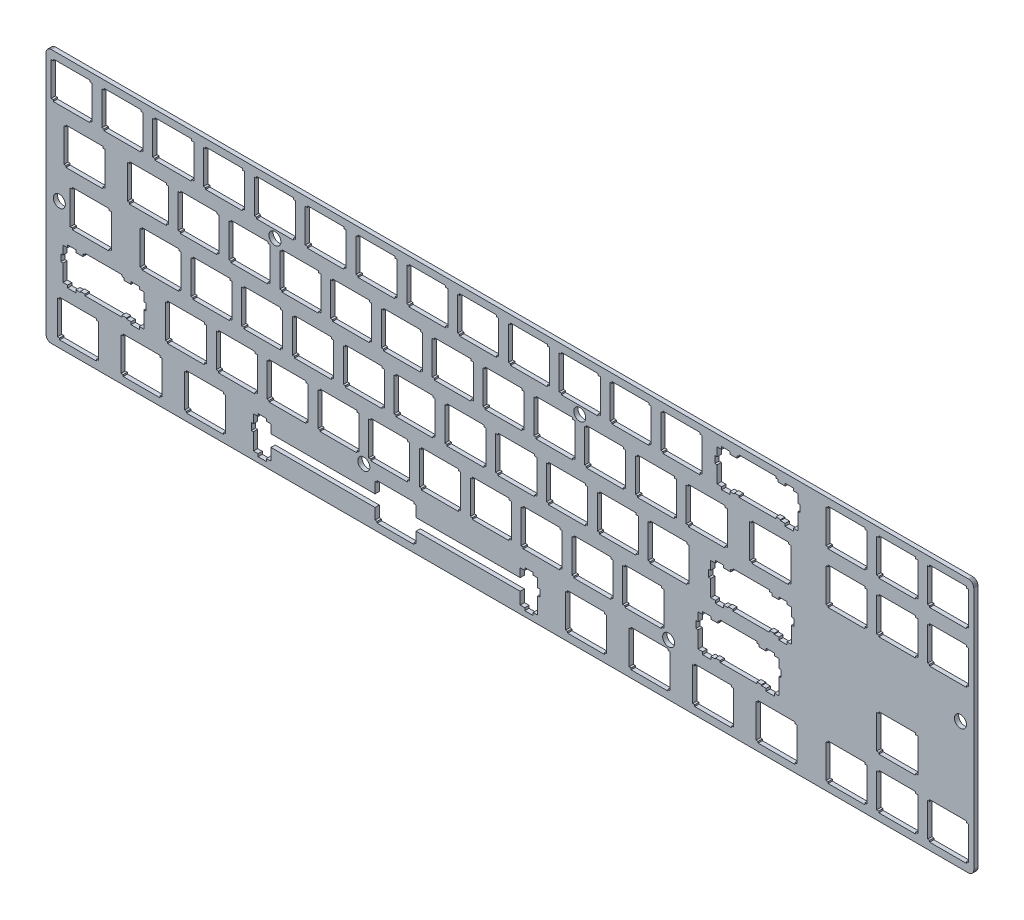
from build123d import *

# Parameters (mm, degrees)
MODEL_R             = 2.25
BOSS_EXTRUDE1_DEPTH = 1.5875


with BuildPart() as part:
    # Model → Boss-Extrude1 (new body)
    with BuildSketch(Plane.XY):
        Polygon((370.515556908, 199.863340857), (370.672556908, 199.856640857), (370.829556908, 199.838640857), (370.982556908, 199.808340857), (371.134556908, 199.765640857), (371.281556908, 199.710640857), (371.423556908, 199.645640857), (371.561556908, 199.568740857), (371.692556908, 199.481640857), (371.815556908, 199.383940857), (371.930556908, 199.277740857), (372.036556908, 199.162040857), (372.134556908, 199.039640857), (372.221556908, 198.908340857), (372.298556908, 198.770840857), (372.363556908, 198.628640857), (372.418556908, 198.482540857), (372.461556908, 198.329840857), (372.491556908, 198.176740857), (372.509556908, 198.019740857), (372.516556908, 197.862740857), (372.516556908, 106.413230857), (372.509556908, 106.256130857), (372.491556908, 106.100410857), (372.461556908, 105.946070857), (372.418556908, 105.794490857), (372.363556908, 105.647040857), (372.298556908, 105.505100857), (372.221556908, 105.368670857), (372.134556908, 105.237760857), (372.036556908, 105.113740857), (371.930556908, 104.997983857), (371.815556908, 104.891874857), (371.692556908, 104.794035857), (371.561556908, 104.707216857), (371.423556908, 104.630046857), (371.281556908, 104.565280857), (371.134556908, 104.510158857), (370.982556908, 104.467440857), (370.829556908, 104.437122857), (370.672556908, 104.419208857), (370.515556908, 104.413695857), (26.653556908, 104.413695857), (26.496456908, 104.419208857), (26.339356908, 104.437122857), (26.186396908, 104.467440857), (26.033436908, 104.510158857), (25.887366908, 104.565280857), (25.745426908, 104.630046857), (25.607616908, 104.707216857), (25.476708908, 104.794035857), (25.354061908, 104.891874857), (25.238308908, 104.997983857), (25.132199908, 105.113740857), (25.034356908, 105.237760857), (24.947541908, 105.368670857), (24.870371908, 105.505100857), (24.805603908, 105.647040857), (24.750481908, 105.794490857), (24.707762908, 105.946070857), (24.677445908, 106.100410857), (24.659531908, 106.256130857), (24.652641508, 106.411850857), (24.652641508, 197.862740857), (24.659531908, 198.019740857), (24.677445908, 198.176740857), (24.707762908, 198.329840857), (24.750481908, 198.482540857), (24.805603908, 198.628640857), (24.870371908, 198.770840857), (24.947541908, 198.908340857), (25.034356908, 199.039640857), (25.132199908, 199.162040857), (25.238308908, 199.277740857), (25.354061908, 199.383940857), (25.476708908, 199.481640857), (25.607616908, 199.568740857), (25.745426908, 199.645640857), (25.887366908, 199.710640857), (26.033436908, 199.765640857), (26.186396908, 199.808340857), (26.339356908, 199.838640857), (26.496456908, 199.856640857), (26.653556908, 199.863340857), align=None)
        with Locations((143.815056908, 123.864140857)):
            Circle(MODEL_R, mode=Mode.SUBTRACT)
        with Locations((110.477456908, 180.414140857)):
            Circle(MODEL_R, mode=Mode.SUBTRACT)
        with Locations((224.778056908, 180.414140857)):
            Circle(MODEL_R, mode=Mode.SUBTRACT)
        with Locations((258.115056908, 123.864140857)):
            Circle(MODEL_R, mode=Mode.SUBTRACT)
        Polygon((148.820556908, 120.939140857), (148.820556908, 120.339640857), (148.021556908, 120.339640857), (148.021556908, 116.238640857), (108.995656908, 116.238640857), (108.995656908, 119.468740857), (107.271556908, 119.468740857), (107.271556908, 120.387940857), (104.171056908, 120.387940857), (104.171056908, 119.468740857), (102.445556908, 119.468740857), (102.445556908, 116.238640857), (101.621556908, 116.238640857), (101.621556908, 113.638280857), (102.445556908, 113.638280857), (102.445556908, 107.369590857), (104.171056908, 107.369590857), (104.171056908, 106.388420857), (107.271556908, 106.388420857), (107.271556908, 107.369590857), (108.995656908, 107.369590857), (108.995656908, 111.838550857), (148.021556908, 111.838550857), (148.021556908, 107.738890857), (148.820556908, 107.738890857), (148.820556908, 107.138080857), (162.620556908, 107.138080857), (162.620556908, 107.738890857), (163.421556908, 107.738890857), (163.421556908, 111.838550857), (202.445556908, 111.838550857), (202.445556908, 107.369590857), (204.171556908, 107.369590857), (204.171556908, 106.388420857), (207.271556908, 106.388420857), (207.271556908, 107.369590857), (208.995556908, 107.369590857), (208.995556908, 113.638280857), (209.820556908, 113.638280857), (209.820556908, 116.238640857), (208.995556908, 116.238640857), (208.995556908, 119.468740857), (207.271556908, 119.468740857), (207.271556908, 120.387940857), (204.171556908, 120.387940857), (204.171556908, 119.468740857), (202.445556908, 119.468740857), (202.445556908, 116.238640857), (163.421556908, 116.238640857), (163.421556908, 120.339640857), (162.620556908, 120.339640857), (162.620556908, 120.939140857), align=None, mode=Mode.SUBTRACT)
        Polygon((355.989556908, 120.939140857), (355.989556908, 120.339640857), (355.190556908, 120.339640857), (355.190556908, 107.738890857), (355.989556908, 107.738890857), (355.989556908, 107.138080857), (369.790556908, 107.138080857), (369.790556908, 107.738890857), (370.589556908, 107.738890857), (370.589556908, 120.339640857), (369.790556908, 120.339640857), (369.790556908, 120.939140857), align=None, mode=Mode.SUBTRACT)
        Polygon((336.939556908, 120.939140857), (336.939556908, 120.339640857), (336.140556908, 120.339640857), (336.140556908, 107.738890857), (336.939556908, 107.738890857), (336.939556908, 107.138080857), (350.740556908, 107.138080857), (350.740556908, 107.738890857), (351.539556908, 107.738890857), (351.539556908, 120.339640857), (350.740556908, 120.339640857), (350.740556908, 120.939140857), align=None, mode=Mode.SUBTRACT)
        Polygon((317.889556908, 120.939140857), (317.889556908, 120.339640857), (317.090556908, 120.339640857), (317.090556908, 107.738890857), (317.889556908, 107.738890857), (317.889556908, 107.138080857), (331.690556908, 107.138080857), (331.690556908, 107.738890857), (332.489556908, 107.738890857), (332.489556908, 120.339640857), (331.690556908, 120.339640857), (331.690556908, 120.939140857), align=None, mode=Mode.SUBTRACT)
        Polygon((291.695556908, 120.939140857), (291.695556908, 120.339640857), (290.896556908, 120.339640857), (290.896556908, 107.738890857), (291.695556908, 107.738890857), (291.695556908, 107.138080857), (305.495556908, 107.138080857), (305.495556908, 107.738890857), (306.296556908, 107.738890857), (306.296556908, 120.339640857), (305.495556908, 120.339640857), (305.495556908, 120.939140857), align=None, mode=Mode.SUBTRACT)
        Polygon((267.884556908, 120.939140857), (267.884556908, 120.339640857), (267.084556908, 120.339640857), (267.084556908, 107.738890857), (267.884556908, 107.738890857), (267.884556908, 107.138080857), (281.684556908, 107.138080857), (281.684556908, 107.738890857), (282.483556908, 107.738890857), (282.483556908, 120.339640857), (281.684556908, 120.339640857), (281.684556908, 120.939140857), align=None, mode=Mode.SUBTRACT)
        Polygon((244.070556908, 120.939140857), (244.070556908, 120.339640857), (243.271556908, 120.339640857), (243.271556908, 107.738890857), (244.070556908, 107.738890857), (244.070556908, 107.138080857), (257.870556908, 107.138080857), (257.870556908, 107.738890857), (258.671556908, 107.738890857), (258.671556908, 120.339640857), (257.870556908, 120.339640857), (257.870556908, 120.939140857), align=None, mode=Mode.SUBTRACT)
        Polygon((220.259556908, 120.939140857), (220.259556908, 120.339640857), (219.459556908, 120.339640857), (219.459556908, 107.738890857), (220.259556908, 107.738890857), (220.259556908, 107.138080857), (234.059556908, 107.138080857), (234.059556908, 107.738890857), (234.858556908, 107.738890857), (234.858556908, 120.339640857), (234.059556908, 120.339640857), (234.059556908, 120.939140857), align=None, mode=Mode.SUBTRACT)
        Polygon((77.384656908, 120.939140857), (77.384656908, 120.339640857), (76.584156908, 120.339640857), (76.584156908, 107.738890857), (77.384656908, 107.738890857), (77.384656908, 107.138080857), (91.184256908, 107.138080857), (91.184256908, 107.738890857), (91.983656908, 107.738890857), (91.983656908, 120.339640857), (91.184256908, 120.339640857), (91.184256908, 120.939140857), align=None, mode=Mode.SUBTRACT)
        Polygon((53.570756908, 120.939140857), (53.570756908, 120.339640857), (52.771556908, 120.339640857), (52.771556908, 107.738890857), (53.570756908, 107.738890857), (53.570756908, 107.138080857), (67.370356908, 107.138080857), (67.370356908, 107.738890857), (68.171156908, 107.738890857), (68.171156908, 120.339640857), (67.370356908, 120.339640857), (67.370356908, 120.939140857), align=None, mode=Mode.SUBTRACT)
        Polygon((29.759656908, 120.939140857), (29.759656908, 120.339640857), (28.959026908, 120.339640857), (28.959026908, 107.738890857), (29.759656908, 107.738890857), (29.759656908, 107.138080857), (43.559356908, 107.138080857), (43.559356908, 107.738890857), (44.358556908, 107.738890857), (44.358556908, 120.339640857), (43.559356908, 120.339640857), (43.559356908, 120.939140857), align=None, mode=Mode.SUBTRACT)
        Polygon((277.408556908, 139.990640857), (277.408556908, 139.389840857), (276.609556908, 139.389840857), (276.609556908, 138.518740857), (275.684556908, 138.518740857), (273.959556908, 138.518740857), (273.959556908, 139.437840857), (270.858556908, 139.437840857), (270.858556908, 138.518740857), (269.134556908, 138.518740857), (269.134556908, 135.288640857), (268.308556908, 135.288640857), (268.308556908, 132.688240857), (269.134556908, 132.688240857), (269.134556908, 126.418240857), (270.858556908, 126.418240857), (270.858556908, 125.438440857), (273.959556908, 125.438440857), (273.959556908, 126.418240857), (275.684556908, 126.418240857), (275.684556908, 126.788840857), (276.609556908, 126.788840857), (277.408556908, 126.788840857), (277.408556908, 126.188040857), (291.209556908, 126.188040857), (291.209556908, 126.788840857), (292.008556908, 126.788840857), (292.934556908, 126.788840857), (292.934556908, 126.418240857), (294.658556908, 126.418240857), (294.658556908, 125.438440857), (297.759556908, 125.438440857), (297.759556908, 126.418240857), (299.484556908, 126.418240857), (299.484556908, 132.688240857), (300.308556908, 132.688240857), (300.308556908, 135.288640857), (299.484556908, 135.288640857), (299.484556908, 138.518740857), (297.759556908, 138.518740857), (297.759556908, 139.437840857), (294.658556908, 139.437840857), (294.658556908, 138.518740857), (292.934556908, 138.518740857), (292.008556908, 138.518740857), (292.008556908, 139.389840857), (291.209556908, 139.389840857), (291.209556908, 139.990640857), align=None, mode=Mode.SUBTRACT)
        Polygon((39.284656908, 139.990640857), (39.284656908, 139.389840857), (38.484056908, 139.389840857), (38.484056908, 138.518740857), (37.559356908, 138.518740857), (35.834056908, 138.518740857), (35.834056908, 139.437840857), (32.733466908, 139.437840857), (32.733466908, 138.518740857), (31.009546908, 138.518740857), (31.009546908, 135.288640857), (30.184076908, 135.288640857), (30.184076908, 132.688240857), (31.009546908, 132.688240857), (31.009546908, 126.418240857), (32.733466908, 126.418240857), (32.733466908, 125.438440857), (35.834056908, 125.438440857), (35.834056908, 126.418240857), (37.559356908, 126.418240857), (37.559356908, 126.788840857), (38.484056908, 126.788840857), (39.284656908, 126.788840857), (39.284656908, 126.188040857), (53.084356908, 126.188040857), (53.084356908, 126.788840857), (53.883556908, 126.788840857), (54.809656908, 126.788840857), (54.809656908, 126.418240857), (56.533556908, 126.418240857), (56.533556908, 125.438440857), (59.634156908, 125.438440857), (59.634156908, 126.418240857), (61.359356908, 126.418240857), (61.359356908, 132.688240857), (62.183456908, 132.688240857), (62.183456908, 135.288640857), (61.359356908, 135.288640857), (61.359356908, 138.518740857), (59.634156908, 138.518740857), (59.634156908, 139.437840857), (56.533556908, 139.437840857), (56.533556908, 138.518740857), (54.809656908, 138.518740857), (53.883556908, 138.518740857), (53.883556908, 139.389840857), (53.084356908, 139.389840857), (53.084356908, 139.990640857), align=None, mode=Mode.SUBTRACT)
        Polygon((299.153556908, 195.668840857), (300.078556908, 195.668840857), (301.803556908, 195.668840857), (301.803556908, 196.589240857), (304.902556908, 196.589240857), (304.902556908, 195.668840857), (306.628556908, 195.668840857), (306.628556908, 192.438740857), (307.453556908, 192.438740857), (307.453556908, 189.838440857), (306.628556908, 189.838440857), (306.628556908, 183.568140857), (304.902556908, 183.568140857), (304.902556908, 182.588540857), (301.803556908, 182.588540857), (301.803556908, 183.568140857), (300.078556908, 183.568140857), (300.078556908, 183.937540857), (299.153556908, 183.937540857), (298.352556908, 183.937540857), (298.352556908, 183.338140857), (284.553556908, 183.338140857), (284.553556908, 183.937540857), (283.752556908, 183.937540857), (282.827556908, 183.937540857), (282.827556908, 183.568140857), (281.102556908, 183.568140857), (281.102556908, 182.588540857), (278.003556908, 182.588540857), (278.003556908, 183.568140857), (276.278556908, 183.568140857), (276.278556908, 189.838440857), (275.452556908, 189.838440857), (275.452556908, 192.438740857), (276.278556908, 192.438740857), (276.278556908, 195.668840857), (278.003556908, 195.668840857), (278.003556908, 196.589240857), (281.102556908, 196.589240857), (281.102556908, 195.668840857), (282.827556908, 195.668840857), (283.752556908, 195.668840857), (283.752556908, 196.538440857), (284.553556908, 196.538440857), (284.553556908, 197.137740857), (298.352556908, 197.137740857), (298.352556908, 196.538440857), (299.153556908, 196.538440857), align=None, mode=Mode.SUBTRACT)
        Polygon((296.771556908, 157.568840857), (297.695556908, 157.568840857), (299.421556908, 157.568840857), (299.421556908, 158.489240857), (302.521556908, 158.489240857), (302.521556908, 157.568840857), (304.245556908, 157.568840857), (304.245556908, 154.338740857), (305.070556908, 154.338740857), (305.070556908, 151.739540857), (304.245556908, 151.739540857), (304.245556908, 145.469640857), (302.521556908, 145.469640857), (302.521556908, 144.488540857), (299.421556908, 144.488540857), (299.421556908, 145.469640857), (297.695556908, 145.469640857), (297.695556908, 145.838940857), (296.771556908, 145.838940857), (295.970556908, 145.838940857), (295.970556908, 145.239540857), (282.170556908, 145.239540857), (282.170556908, 145.838940857), (281.371556908, 145.838940857), (280.445556908, 145.838940857), (280.445556908, 145.469640857), (278.720556908, 145.469640857), (278.720556908, 144.488540857), (275.620556908, 144.488540857), (275.620556908, 145.469640857), (273.895556908, 145.469640857), (273.895556908, 151.739540857), (273.071556908, 151.739540857), (273.071556908, 154.338740857), (273.895556908, 154.338740857), (273.895556908, 157.568840857), (275.620556908, 157.568840857), (275.620556908, 158.489240857), (278.720556908, 158.489240857), (278.720556908, 157.568840857), (280.445556908, 157.568840857), (281.371556908, 157.568840857), (281.371556908, 158.438440857), (282.170556908, 158.438440857), (282.170556908, 159.039240857), (295.970556908, 159.039240857), (295.970556908, 158.438440857), (296.771556908, 158.438440857), align=None, mode=Mode.SUBTRACT)
        Polygon((336.939556908, 139.990640857), (336.939556908, 139.389840857), (336.140556908, 139.389840857), (336.140556908, 126.788840857), (336.939556908, 126.788840857), (336.939556908, 126.188040857), (350.740556908, 126.188040857), (350.740556908, 126.788840857), (351.539556908, 126.788840857), (351.539556908, 139.389840857), (350.740556908, 139.389840857), (350.740556908, 139.990640857), align=None, mode=Mode.SUBTRACT)
        Polygon((241.689556908, 139.990640857), (241.689556908, 139.389840857), (240.890556908, 139.389840857), (240.890556908, 126.788840857), (241.689556908, 126.788840857), (241.689556908, 126.188040857), (255.490556908, 126.188040857), (255.490556908, 126.788840857), (256.289556908, 126.788840857), (256.289556908, 139.389840857), (255.490556908, 139.389840857), (255.490556908, 139.990640857), align=None, mode=Mode.SUBTRACT)
        Polygon((222.639556908, 139.990640857), (222.639556908, 139.389840857), (221.840556908, 139.389840857), (221.840556908, 126.788840857), (222.639556908, 126.788840857), (222.639556908, 126.188040857), (236.440556908, 126.188040857), (236.440556908, 126.788840857), (237.239556908, 126.788840857), (237.239556908, 139.389840857), (236.440556908, 139.389840857), (236.440556908, 139.990640857), align=None, mode=Mode.SUBTRACT)
        Polygon((203.589556908, 139.990640857), (203.589556908, 139.389840857), (202.790556908, 139.389840857), (202.790556908, 126.788840857), (203.589556908, 126.788840857), (203.589556908, 126.188040857), (217.390556908, 126.188040857), (217.390556908, 126.788840857), (218.189556908, 126.788840857), (218.189556908, 139.389840857), (217.390556908, 139.389840857), (217.390556908, 139.990640857), align=None, mode=Mode.SUBTRACT)
        Polygon((184.539556908, 139.990640857), (184.539556908, 139.389840857), (183.740556908, 139.389840857), (183.740556908, 126.788840857), (184.539556908, 126.788840857), (184.539556908, 126.188040857), (198.340556908, 126.188040857), (198.340556908, 126.788840857), (199.139556908, 126.788840857), (199.139556908, 139.389840857), (198.340556908, 139.389840857), (198.340556908, 139.990640857), align=None, mode=Mode.SUBTRACT)
        Polygon((165.489556908, 139.990640857), (165.489556908, 139.389840857), (164.690556908, 139.389840857), (164.690556908, 126.788840857), (165.489556908, 126.788840857), (165.489556908, 126.188040857), (179.290556908, 126.188040857), (179.290556908, 126.788840857), (180.089556908, 126.788840857), (180.089556908, 139.389840857), (179.290556908, 139.389840857), (179.290556908, 139.990640857), align=None, mode=Mode.SUBTRACT)
        Polygon((146.439556908, 139.990640857), (146.439556908, 139.389840857), (145.640556908, 139.389840857), (145.640556908, 126.788840857), (146.439556908, 126.788840857), (146.439556908, 126.188040857), (160.240556908, 126.188040857), (160.240556908, 126.788840857), (161.039556908, 126.788840857), (161.039556908, 139.389840857), (160.240556908, 139.389840857), (160.240556908, 139.990640857), align=None, mode=Mode.SUBTRACT)
        Polygon((127.389556908, 139.990640857), (127.389556908, 139.389840857), (126.590556908, 139.389840857), (126.590556908, 126.788840857), (127.389556908, 126.788840857), (127.389556908, 126.188040857), (141.190556908, 126.188040857), (141.190556908, 126.788840857), (141.989556908, 126.788840857), (141.989556908, 139.389840857), (141.190556908, 139.389840857), (141.190556908, 139.990640857), align=None, mode=Mode.SUBTRACT)
        Polygon((108.339456908, 139.990640857), (108.339456908, 139.389840857), (107.540456908, 139.389840857), (107.540456908, 126.788840857), (108.339456908, 126.788840857), (108.339456908, 126.188040857), (122.140456908, 126.188040857), (122.140456908, 126.788840857), (122.939856908, 126.788840857), (122.939856908, 139.389840857), (122.140456908, 139.389840857), (122.140456908, 139.990640857), align=None, mode=Mode.SUBTRACT)
        Polygon((89.289456908, 139.990640857), (89.289456908, 139.389840857), (88.490456908, 139.389840857), (88.490456908, 126.788840857), (89.289456908, 126.788840857), (89.289456908, 126.188040857), (103.090456908, 126.188040857), (103.090456908, 126.788840857), (103.889856908, 126.788840857), (103.889856908, 139.389840857), (103.090456908, 139.389840857), (103.090456908, 139.990640857), align=None, mode=Mode.SUBTRACT)
        Polygon((70.239456908, 139.990640857), (70.239456908, 139.389840857), (69.440456908, 139.389840857), (69.440456908, 126.788840857), (70.239456908, 126.788840857), (70.239456908, 126.188040857), (84.040456908, 126.188040857), (84.040456908, 126.788840857), (84.839856908, 126.788840857), (84.839856908, 139.389840857), (84.040456908, 139.389840857), (84.040456908, 139.990640857), align=None, mode=Mode.SUBTRACT)
        Polygon((251.214556908, 159.039240857), (251.214556908, 158.438440857), (250.415556908, 158.438440857), (250.415556908, 145.838940857), (251.214556908, 145.838940857), (251.214556908, 145.239540857), (265.015556908, 145.239540857), (265.015556908, 145.838940857), (265.814556908, 145.838940857), (265.814556908, 158.438440857), (265.015556908, 158.438440857), (265.015556908, 159.039240857), align=None, mode=Mode.SUBTRACT)
        Polygon((232.164556908, 159.039240857), (232.164556908, 158.438440857), (231.365556908, 158.438440857), (231.365556908, 145.838940857), (232.164556908, 145.838940857), (232.164556908, 145.239540857), (245.965556908, 145.239540857), (245.965556908, 145.838940857), (246.764556908, 145.838940857), (246.764556908, 158.438440857), (245.965556908, 158.438440857), (245.965556908, 159.039240857), align=None, mode=Mode.SUBTRACT)
        Polygon((213.114556908, 159.039240857), (213.114556908, 158.438440857), (212.315556908, 158.438440857), (212.315556908, 145.838940857), (213.114556908, 145.838940857), (213.114556908, 145.239540857), (226.915556908, 145.239540857), (226.915556908, 145.838940857), (227.714556908, 145.838940857), (227.714556908, 158.438440857), (226.915556908, 158.438440857), (226.915556908, 159.039240857), align=None, mode=Mode.SUBTRACT)
        Polygon((194.064556908, 159.039240857), (194.064556908, 158.438440857), (193.265556908, 158.438440857), (193.265556908, 145.838940857), (194.064556908, 145.838940857), (194.064556908, 145.239540857), (207.865556908, 145.239540857), (207.865556908, 145.838940857), (208.664556908, 145.838940857), (208.664556908, 158.438440857), (207.865556908, 158.438440857), (207.865556908, 159.039240857), align=None, mode=Mode.SUBTRACT)
        Polygon((175.014556908, 159.039240857), (175.014556908, 158.438440857), (174.215556908, 158.438440857), (174.215556908, 145.838940857), (175.014556908, 145.838940857), (175.014556908, 145.239540857), (188.815556908, 145.239540857), (188.815556908, 145.838940857), (189.614556908, 145.838940857), (189.614556908, 158.438440857), (188.815556908, 158.438440857), (188.815556908, 159.039240857), align=None, mode=Mode.SUBTRACT)
        Polygon((155.964556908, 159.039240857), (155.964556908, 158.438440857), (155.165556908, 158.438440857), (155.165556908, 145.838940857), (155.964556908, 145.838940857), (155.964556908, 145.239540857), (169.765556908, 145.239540857), (169.765556908, 145.838940857), (170.564556908, 145.838940857), (170.564556908, 158.438440857), (169.765556908, 158.438440857), (169.765556908, 159.039240857), align=None, mode=Mode.SUBTRACT)
        Polygon((136.914556908, 159.039240857), (136.914556908, 158.438440857), (136.115556908, 158.438440857), (136.115556908, 145.838940857), (136.914556908, 145.838940857), (136.914556908, 145.239540857), (150.715556908, 145.239540857), (150.715556908, 145.838940857), (151.514556908, 145.838940857), (151.514556908, 158.438440857), (150.715556908, 158.438440857), (150.715556908, 159.039240857), align=None, mode=Mode.SUBTRACT)
        Polygon((117.864456908, 159.039240857), (117.864456908, 158.438440857), (117.065456908, 158.438440857), (117.065456908, 145.838940857), (117.864456908, 145.838940857), (117.864456908, 145.239540857), (131.665556908, 145.239540857), (131.665556908, 145.838940857), (132.464556908, 145.838940857), (132.464556908, 158.438440857), (131.665556908, 158.438440857), (131.665556908, 159.039240857), align=None, mode=Mode.SUBTRACT)
        Polygon((98.814456908, 159.039240857), (98.814456908, 158.438440857), (98.015456908, 158.438440857), (98.015456908, 145.838940857), (98.814456908, 145.838940857), (98.814456908, 145.239540857), (112.615456908, 145.239540857), (112.615456908, 145.838940857), (113.414856908, 145.838940857), (113.414856908, 158.438440857), (112.615456908, 158.438440857), (112.615456908, 159.039240857), align=None, mode=Mode.SUBTRACT)
        Polygon((79.764456908, 159.039240857), (79.764456908, 158.438440857), (78.965456908, 158.438440857), (78.965456908, 145.838940857), (79.764456908, 145.838940857), (79.764456908, 145.239540857), (93.565456908, 145.239540857), (93.565456908, 145.838940857), (94.364856908, 145.838940857), (94.364856908, 158.438440857), (93.565456908, 158.438440857), (93.565456908, 159.039240857), align=None, mode=Mode.SUBTRACT)
        Polygon((60.714456908, 159.039240857), (60.714456908, 158.438440857), (59.915456908, 158.438440857), (59.915456908, 145.838940857), (60.714456908, 145.838940857), (60.714456908, 145.239540857), (74.515456908, 145.239540857), (74.515456908, 145.838940857), (75.314856908, 145.838940857), (75.314856908, 158.438440857), (74.515456908, 158.438440857), (74.515456908, 159.039240857), align=None, mode=Mode.SUBTRACT)
        Polygon((34.520776908, 159.039240857), (34.520776908, 158.438440857), (33.721526908, 158.438440857), (33.721526908, 145.838940857), (34.520776908, 145.838940857), (34.520776908, 145.239540857), (48.320456908, 145.239540857), (48.320456908, 145.838940857), (49.121056908, 145.838940857), (49.121056908, 158.438440857), (48.320456908, 158.438440857), (48.320456908, 159.039240857), align=None, mode=Mode.SUBTRACT)
        Polygon((355.989556908, 178.087740857), (355.989556908, 177.489840857), (355.190556908, 177.489840857), (355.190556908, 164.888940857), (355.989556908, 164.888940857), (355.989556908, 164.289540857), (369.790556908, 164.289540857), (369.790556908, 164.888940857), (370.589556908, 164.888940857), (370.589556908, 177.489840857), (369.790556908, 177.489840857), (369.790556908, 178.087740857), align=None, mode=Mode.SUBTRACT)
        Polygon((336.939556908, 178.087740857), (336.939556908, 177.489840857), (336.140556908, 177.489840857), (336.140556908, 164.888940857), (336.939556908, 164.888940857), (336.939556908, 164.289540857), (350.740556908, 164.289540857), (350.740556908, 164.888940857), (351.539556908, 164.888940857), (351.539556908, 177.489840857), (350.740556908, 177.489840857), (350.740556908, 178.087740857), align=None, mode=Mode.SUBTRACT)
        Polygon((317.889556908, 178.087740857), (317.889556908, 177.489840857), (317.090556908, 177.489840857), (317.090556908, 164.888940857), (317.889556908, 164.888940857), (317.889556908, 164.289540857), (331.690556908, 164.289540857), (331.690556908, 164.888940857), (332.489556908, 164.888940857), (332.489556908, 177.489840857), (331.690556908, 177.489840857), (331.690556908, 178.087740857), align=None, mode=Mode.SUBTRACT)
        Polygon((289.314556908, 178.087740857), (289.314556908, 177.489840857), (288.515556908, 177.489840857), (288.515556908, 164.888940857), (289.314556908, 164.888940857), (289.314556908, 164.289540857), (303.115556908, 164.289540857), (303.115556908, 164.888940857), (303.914556908, 164.888940857), (303.914556908, 177.489840857), (303.115556908, 177.489840857), (303.115556908, 178.087740857), align=None, mode=Mode.SUBTRACT)
        Polygon((265.503556908, 178.087740857), (265.503556908, 177.489840857), (264.702556908, 177.489840857), (264.702556908, 164.888940857), (265.503556908, 164.888940857), (265.503556908, 164.289540857), (279.301556908, 164.289540857), (279.301556908, 164.888940857), (280.103556908, 164.888940857), (280.103556908, 177.489840857), (279.301556908, 177.489840857), (279.301556908, 178.087740857), align=None, mode=Mode.SUBTRACT)
        Polygon((246.453556908, 178.087740857), (246.453556908, 177.489840857), (245.652556908, 177.489840857), (245.652556908, 164.888940857), (246.453556908, 164.888940857), (246.453556908, 164.289540857), (260.252556908, 164.289540857), (260.252556908, 164.888940857), (261.053556908, 164.888940857), (261.053556908, 177.489840857), (260.252556908, 177.489840857), (260.252556908, 178.087740857), align=None, mode=Mode.SUBTRACT)
        Polygon((227.403556908, 178.087740857), (227.403556908, 177.489840857), (226.602556908, 177.489840857), (226.602556908, 164.888940857), (227.403556908, 164.888940857), (227.403556908, 164.289540857), (241.202556908, 164.289540857), (241.202556908, 164.888940857), (242.003556908, 164.888940857), (242.003556908, 177.489840857), (241.202556908, 177.489840857), (241.202556908, 178.087740857), align=None, mode=Mode.SUBTRACT)
        Polygon((208.353556908, 178.087740857), (208.353556908, 177.489840857), (207.552556908, 177.489840857), (207.552556908, 164.888940857), (208.353556908, 164.888940857), (208.353556908, 164.289540857), (222.152556908, 164.289540857), (222.152556908, 164.888940857), (222.953556908, 164.888940857), (222.953556908, 177.489840857), (222.152556908, 177.489840857), (222.152556908, 178.087740857), align=None, mode=Mode.SUBTRACT)
        Polygon((189.303556908, 178.087740857), (189.303556908, 177.489840857), (188.502556908, 177.489840857), (188.502556908, 164.888940857), (189.303556908, 164.888940857), (189.303556908, 164.289540857), (203.102556908, 164.289540857), (203.102556908, 164.888940857), (203.903556908, 164.888940857), (203.903556908, 177.489840857), (203.102556908, 177.489840857), (203.102556908, 178.087740857), align=None, mode=Mode.SUBTRACT)
        Polygon((170.253556908, 178.087740857), (170.253556908, 177.489840857), (169.452556908, 177.489840857), (169.452556908, 164.888940857), (170.253556908, 164.888940857), (170.253556908, 164.289540857), (184.052556908, 164.289540857), (184.052556908, 164.888940857), (184.853556908, 164.888940857), (184.853556908, 177.489840857), (184.052556908, 177.489840857), (184.052556908, 178.087740857), align=None, mode=Mode.SUBTRACT)
        Polygon((151.201556908, 178.087740857), (151.201556908, 177.489840857), (150.402556908, 177.489840857), (150.402556908, 164.888940857), (151.201556908, 164.888940857), (151.201556908, 164.289540857), (165.002556908, 164.289540857), (165.002556908, 164.888940857), (165.802556908, 164.888940857), (165.802556908, 177.489840857), (165.002556908, 177.489840857), (165.002556908, 178.087740857), align=None, mode=Mode.SUBTRACT)
        Polygon((132.151556908, 178.087740857), (132.151556908, 177.489840857), (131.351556908, 177.489840857), (131.351556908, 164.888940857), (132.151556908, 164.888940857), (132.151556908, 164.289540857), (145.952556908, 164.289540857), (145.952556908, 164.888940857), (146.753556908, 164.888940857), (146.753556908, 177.489840857), (145.952556908, 177.489840857), (145.952556908, 178.087740857), align=None, mode=Mode.SUBTRACT)
        Polygon((113.101956908, 178.087740857), (113.101956908, 177.489840857), (112.301556908, 177.489840857), (112.301556908, 164.888940857), (113.101956908, 164.888940857), (113.101956908, 164.289540857), (126.902556908, 164.289540857), (126.902556908, 164.888940857), (127.703556908, 164.888940857), (127.703556908, 177.489840857), (126.902556908, 177.489840857), (126.902556908, 178.087740857), align=None, mode=Mode.SUBTRACT)
        Polygon((94.051956908, 178.087740857), (94.051956908, 177.489840857), (93.252956908, 177.489840857), (93.252956908, 164.888940857), (94.051956908, 164.888940857), (94.051956908, 164.289540857), (107.852956908, 164.289540857), (107.852956908, 164.888940857), (108.653756908, 164.888940857), (108.653756908, 177.489840857), (107.852956908, 177.489840857), (107.852956908, 178.087740857), align=None, mode=Mode.SUBTRACT)
        Polygon((75.003356908, 178.087740857), (75.003356908, 177.489840857), (74.202956908, 177.489840857), (74.202956908, 164.888940857), (75.003356908, 164.888940857), (75.003356908, 164.289540857), (88.802956908, 164.289540857), (88.802956908, 164.888940857), (89.603756908, 164.888940857), (89.603756908, 177.489840857), (88.802956908, 177.489840857), (88.802956908, 178.087740857), align=None, mode=Mode.SUBTRACT)
        Polygon((55.953356908, 178.087740857), (55.953356908, 177.489840857), (55.152756908, 177.489840857), (55.152756908, 164.888940857), (55.953356908, 164.888940857), (55.953356908, 164.289540857), (69.752956908, 164.289540857), (69.752956908, 164.888940857), (70.553756908, 164.888940857), (70.553756908, 177.489840857), (69.752956908, 177.489840857), (69.752956908, 178.087740857), align=None, mode=Mode.SUBTRACT)
        Polygon((32.139526908, 178.087740857), (32.139526908, 177.489840857), (31.340276908, 177.489840857), (31.340276908, 164.888940857), (32.139526908, 164.888940857), (32.139526908, 164.289540857), (45.940556908, 164.289540857), (45.940556908, 164.888940857), (46.739856908, 164.888940857), (46.739856908, 177.489840857), (45.940556908, 177.489840857), (45.940556908, 178.087740857), align=None, mode=Mode.SUBTRACT)
        Polygon((355.989556908, 197.137740857), (355.989556908, 196.538440857), (355.190556908, 196.538440857), (355.190556908, 183.937540857), (355.989556908, 183.937540857), (355.989556908, 183.338140857), (369.790556908, 183.338140857), (369.790556908, 183.937540857), (370.589556908, 183.937540857), (370.589556908, 196.538440857), (369.790556908, 196.538440857), (369.790556908, 197.137740857), align=None, mode=Mode.SUBTRACT)
        Polygon((336.939556908, 197.137740857), (336.939556908, 196.538440857), (336.140556908, 196.538440857), (336.140556908, 183.937540857), (336.939556908, 183.937540857), (336.939556908, 183.338140857), (350.740556908, 183.338140857), (350.740556908, 183.937540857), (351.539556908, 183.937540857), (351.539556908, 196.538440857), (350.740556908, 196.538440857), (350.740556908, 197.137740857), align=None, mode=Mode.SUBTRACT)
        Polygon((317.889556908, 197.137740857), (317.889556908, 196.538440857), (317.090556908, 196.538440857), (317.090556908, 183.937540857), (317.889556908, 183.937540857), (317.889556908, 183.338140857), (331.690556908, 183.338140857), (331.690556908, 183.937540857), (332.489556908, 183.937540857), (332.489556908, 196.538440857), (331.690556908, 196.538440857), (331.690556908, 197.137740857), align=None, mode=Mode.SUBTRACT)
        Polygon((255.978556908, 197.137740857), (255.978556908, 196.538440857), (255.177556908, 196.538440857), (255.177556908, 183.937540857), (255.978556908, 183.937540857), (255.978556908, 183.338140857), (269.777556908, 183.338140857), (269.777556908, 183.937540857), (270.578556908, 183.937540857), (270.578556908, 196.538440857), (269.777556908, 196.538440857), (269.777556908, 197.137740857), align=None, mode=Mode.SUBTRACT)
        Polygon((236.928556908, 197.137740857), (236.928556908, 196.538440857), (236.127556908, 196.538440857), (236.127556908, 183.937540857), (236.928556908, 183.937540857), (236.928556908, 183.338140857), (250.727556908, 183.338140857), (250.727556908, 183.937540857), (251.528556908, 183.937540857), (251.528556908, 196.538440857), (250.727556908, 196.538440857), (250.727556908, 197.137740857), align=None, mode=Mode.SUBTRACT)
        Polygon((217.878556908, 197.137740857), (217.878556908, 196.538440857), (217.077556908, 196.538440857), (217.077556908, 183.937540857), (217.878556908, 183.937540857), (217.878556908, 183.338140857), (231.677556908, 183.338140857), (231.677556908, 183.937540857), (232.478556908, 183.937540857), (232.478556908, 196.538440857), (231.677556908, 196.538440857), (231.677556908, 197.137740857), align=None, mode=Mode.SUBTRACT)
        Polygon((198.828556908, 197.137740857), (198.828556908, 196.538440857), (198.027556908, 196.538440857), (198.027556908, 183.937540857), (198.828556908, 183.937540857), (198.828556908, 183.338140857), (212.627556908, 183.338140857), (212.627556908, 183.937540857), (213.428556908, 183.937540857), (213.428556908, 196.538440857), (212.627556908, 196.538440857), (212.627556908, 197.137740857), align=None, mode=Mode.SUBTRACT)
        Polygon((179.778556908, 197.137740857), (179.778556908, 196.538440857), (178.977556908, 196.538440857), (178.977556908, 183.937540857), (179.778556908, 183.937540857), (179.778556908, 183.338140857), (193.577556908, 183.338140857), (193.577556908, 183.937540857), (194.378556908, 183.937540857), (194.378556908, 196.538440857), (193.577556908, 196.538440857), (193.577556908, 197.137740857), align=None, mode=Mode.SUBTRACT)
        Polygon((160.728556908, 197.137740857), (160.728556908, 196.538440857), (159.927556908, 196.538440857), (159.927556908, 183.937540857), (160.728556908, 183.937540857), (160.728556908, 183.338140857), (174.527556908, 183.338140857), (174.527556908, 183.937540857), (175.327556908, 183.937540857), (175.327556908, 196.538440857), (174.527556908, 196.538440857), (174.527556908, 197.137740857), align=None, mode=Mode.SUBTRACT)
        Polygon((141.676556908, 197.137740857), (141.676556908, 196.538440857), (140.876556908, 196.538440857), (140.876556908, 183.937540857), (141.676556908, 183.937540857), (141.676556908, 183.338140857), (155.477556908, 183.338140857), (155.477556908, 183.937540857), (156.277556908, 183.937540857), (156.277556908, 196.538440857), (155.477556908, 196.538440857), (155.477556908, 197.137740857), align=None, mode=Mode.SUBTRACT)
        Polygon((122.626956908, 197.137740857), (122.626956908, 196.538440857), (121.826456908, 196.538440857), (121.826456908, 183.937540857), (122.626956908, 183.937540857), (122.626956908, 183.338140857), (136.426556908, 183.338140857), (136.426556908, 183.937540857), (137.227556908, 183.937540857), (137.227556908, 196.538440857), (136.426556908, 196.538440857), (136.426556908, 197.137740857), align=None, mode=Mode.SUBTRACT)
        Polygon((103.576956908, 197.137740857), (103.576956908, 196.538440857), (102.776556908, 196.538440857), (102.776556908, 183.937540857), (103.576956908, 183.937540857), (103.576956908, 183.338140857), (117.377956908, 183.338140857), (117.377956908, 183.937540857), (118.177356908, 183.937540857), (118.177356908, 196.538440857), (117.377956908, 196.538440857), (117.377956908, 197.137740857), align=None, mode=Mode.SUBTRACT)
        Polygon((84.525556908, 197.137740857), (84.525556908, 196.538440857), (83.726456908, 196.538440857), (83.726456908, 183.937540857), (84.525556908, 183.937540857), (84.525556908, 183.338140857), (98.327956908, 183.338140857), (98.327956908, 183.937540857), (99.128756908, 183.937540857), (99.128756908, 196.538440857), (98.327956908, 196.538440857), (98.327956908, 197.137740857), align=None, mode=Mode.SUBTRACT)
        Polygon((65.476956908, 197.137740857), (65.476956908, 196.538440857), (64.676456908, 196.538440857), (64.676456908, 183.937540857), (65.476956908, 183.937540857), (65.476956908, 183.338140857), (79.276556908, 183.338140857), (79.276556908, 183.937540857), (80.078756908, 183.937540857), (80.078756908, 196.538440857), (79.276556908, 196.538440857), (79.276556908, 197.137740857), align=None, mode=Mode.SUBTRACT)
        Polygon((46.428356908, 197.137740857), (46.428356908, 196.538440857), (45.626356908, 196.538440857), (45.626356908, 183.937540857), (46.428356908, 183.937540857), (46.428356908, 183.338140857), (60.226556908, 183.338140857), (60.226556908, 183.937540857), (61.028756908, 183.937540857), (61.028756908, 196.538440857), (60.226556908, 196.538440857), (60.226556908, 197.137740857), align=None, mode=Mode.SUBTRACT)
        Polygon((27.378396908, 197.137740857), (27.378396908, 196.538440857), (26.577756908, 196.538440857), (26.577756908, 183.937540857), (27.378396908, 183.937540857), (27.378396908, 183.338140857), (41.178056908, 183.338140857), (41.178056908, 183.937540857), (41.978756908, 183.937540857), (41.978756908, 196.538440857), (41.178056908, 196.538440857), (41.178056908, 197.137740857), align=None, mode=Mode.SUBTRACT)
        with BuildLine():
            ThreePointArc((367.516556908, 154.388340857), (365.266556908, 152.138340857), (367.516556908, 149.888340857))
            ThreePointArc((367.516556908, 149.888340857), (369.766556908, 152.138340857), (367.516556908, 154.388340857))
        make_face(mode=Mode.SUBTRACT)
        with BuildLine():
            ThreePointArc((29.652641508, 149.888340857), (31.902641508, 152.138340857), (29.652641508, 154.388340857))
            ThreePointArc((29.652641508, 154.388340857), (27.402641508, 152.138340857), (29.652641508, 149.888340857))
        make_face(mode=Mode.SUBTRACT)
    extrude(amount=BOSS_EXTRUDE1_DEPTH)


solid = part.part
